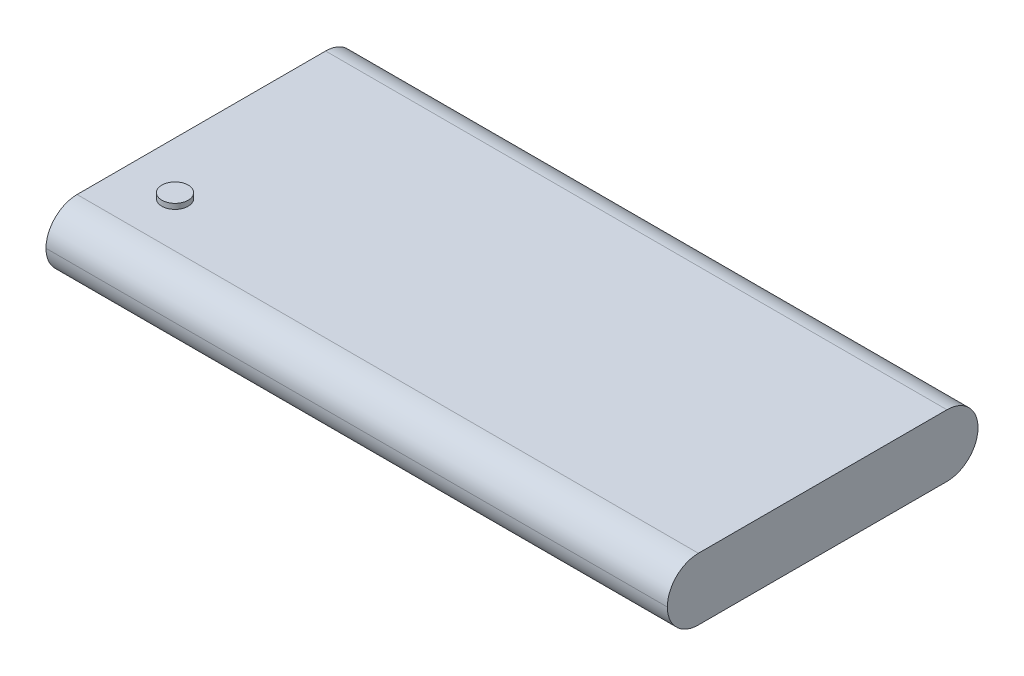
from build123d import *

# Parameters (mm, degrees)
SKETCH1_W           = 150
SKETCH1_H           = 75
BOSS_EXTRUDE1_DEPTH = 7.5
FILLET1_R           = 7.5
SKETCH2_R           = 3.175
BOSS_EXTRUDE2_DEPTH = 1.27


with BuildPart() as part:
    # Sketch1 → Boss-Extrude1 (new, symmetric)
    with BuildSketch(Plane(origin=(0, 0, 0), x_dir=(1, 0, 0), z_dir=(0, 1, 0))):
        Rectangle(SKETCH1_W, SKETCH1_H)
    extrude(amount=BOSS_EXTRUDE1_DEPTH, both=True)

    # Fillet1
    fillet1_edges = [part.edges().sort_by_distance(p)[0] for p in [
        (0, -7.5, -37.5),
        (0, 7.5, -37.5),
        (0, -7.5, 37.5),
        (0, 7.5, 37.5),
    ]]
    fillet(fillet1_edges, radius=FILLET1_R - 0.0001)  # a hair under: the kernel refuses the full size

    # Sketch2 → Boss-Extrude2 (add)
    with BuildSketch(Plane(origin=(0, 7.5, 0), x_dir=(1, 0, 0), z_dir=(0, 1, 0))):
        with Locations(Location((-62.3, -19.05, 0), (0, 0, 90))):
            Circle(SKETCH2_R)
    extrude(amount=BOSS_EXTRUDE2_DEPTH)


solid = part.part
